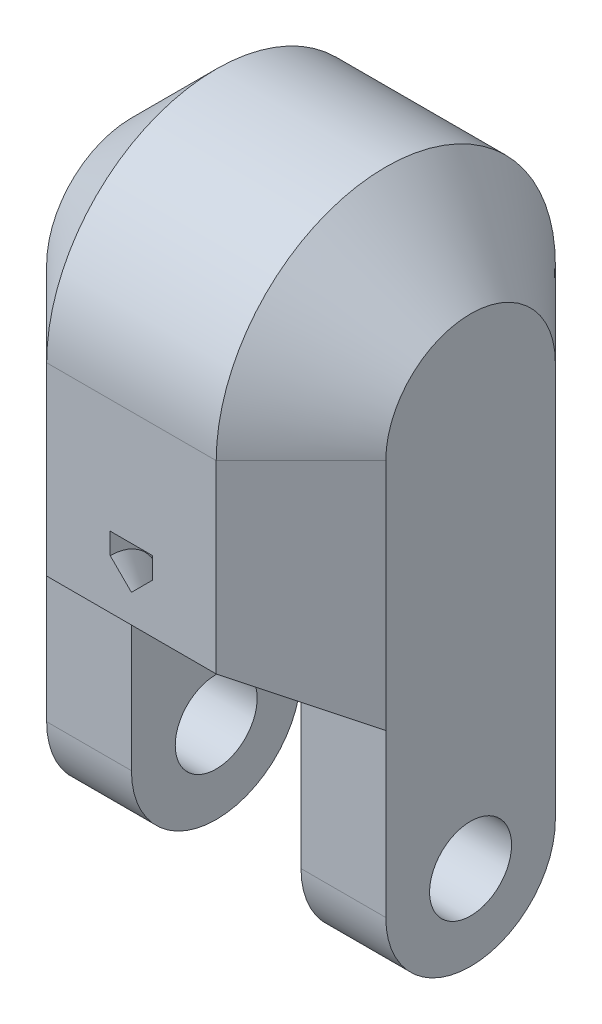
from build123d import *

# Parameters (mm, degrees)
BOSS_EXTRUDE1_DEPTH     = 5
CUT_EXTRUDE8_DEPTH      = 10.848857802
CUT_EXTRUDE8_DEPTH_BACK = 10.848857802
REVOLVE1_ANGLE          = 180
SKETCH24_W              = 3
SKETCH24_H              = 6
BOSS_EXTRUDE2_DEPTH     = 4
SKETCH25_W              = 3
SKETCH25_H              = 3
REVOLVE2_ANGLE          = 180
SKETCH26_R              = 1.45
CUT_EXTRUDE9_DEPTH      = 19
BOSS_EXTRUDE4_DEPTH     = 3.75


with BuildPart() as part:
    # Sketch2 → Boss-Extrude1 (new, symmetric)
    with BuildSketch(Plane(origin=(0, 0, 0), x_dir=(1, 0, 0), z_dir=(0, 1, 0))):
        Polygon((-3, 6), (3, 6), (6, 3), (6, -3), (3, -6), (-3, -6), (-6, -3), (-6, 3), align=None)
    extrude(amount=BOSS_EXTRUDE1_DEPTH, both=True)

    # Sketch22 → Cut-Extrude8 (cut, two sides: drawn at the far end of the back side and taken through both)
    with BuildSketch(Plane(origin=(0, 0, 0), x_dir=(0, 0, -1), z_dir=(1, 0, 0)).offset(-CUT_EXTRUDE8_DEPTH_BACK)):
        Polygon((0, -5), (-6, -5), (-6, -1.535898385), align=None)
    extrude(amount=CUT_EXTRUDE8_DEPTH + CUT_EXTRUDE8_DEPTH_BACK, mode=Mode.SUBTRACT)

    # Sketch23 → Revolve1 (revolve)
    with BuildSketch(Plane(origin=(0, 5, 0), x_dir=(1, 0, 0), z_dir=(0, 1, 0))):
        Polygon((-6, 0), (-6, 3), (-3, 6), (3, 6), (6, 3), (6, 0), align=None)
    revolve(axis=Axis((6, 5, 0), (1, 0, 0)), revolution_arc=REVOLVE1_ANGLE)

    # Sketch24 → Boss-Extrude2 (add, symmetric)
    with BuildSketch(Plane.XZ.offset(5)):
        with Locations((-4.5, 0)):
            Rectangle(SKETCH24_W, SKETCH24_H)
    boss_extrude2 = extrude(amount=BOSS_EXTRUDE2_DEPTH, both=True)

    # Sketch25 → Revolve2 (revolve)
    with BuildSketch(Plane.XZ.offset(9)):
        with Locations((-4.5, 1.5)):
            Rectangle(SKETCH25_W, SKETCH25_H)
    revolve2 = revolve(axis=Axis((-6, -9, 0), (1, 0, 0)), revolution_arc=REVOLVE2_ANGLE)

    # Sketch26 → Cut-Extrude9 (cut, symmetric)
    with BuildSketch(Plane.ZY.offset(6)):
        with Locations((0, -9)):
            Circle(SKETCH26_R)
    cut_extrude9 = extrude(amount=CUT_EXTRUDE9_DEPTH, both=True, mode=Mode.SUBTRACT)

    # Mirror1: Boss-Extrude2, Revolve2, Cut-Extrude9 across plane
    add(boss_extrude2.mirror(Plane(origin=(0, 0, 0), x_dir=(0, 0, 1), z_dir=(1, 0, 0))))
    add(revolve2.mirror(Plane(origin=(0, 0, 0), x_dir=(0, 0, 1), z_dir=(1, 0, 0))))
    add(cut_extrude9.mirror(Plane(origin=(0, 0, 0), x_dir=(0, 0, 1), z_dir=(1, 0, 0))), mode=Mode.SUBTRACT)

    # Sketch30 → Cut-Revolve1 (revolve, cut)
    with BuildSketch(Plane(origin=(0, -3.75, 2.165063509), x_dir=(1, 0, 0), z_dir=(0, -0.8660254037844418, 0.49999999999999484))):
        Polygon((0, 3.42820323), (-0.75, 2.67820323), (-0.75, 1.92820323), (0.75, 1.92820323), (0.75, 2.67820323), align=None)
    revolve(axis=Axis((-6, -1.535898385, 6), (1, 0, 0)), mode=Mode.SUBTRACT)

    # Sketch34 → Boss-Extrude4 (add)
    with BuildSketch(Plane.XZ.offset(5)):
        Polygon((-6, -3), (-3, -3), (3, -3), (6, -3), (3, -6), (-3, -6), align=None)
    extrude(amount=BOSS_EXTRUDE4_DEPTH)

    # Sketch35 → Cut-Revolve3 (revolve, cut)
    with BuildSketch(Plane.XZ.offset(8.75)):
        Polygon((0, -3.5), (-0.75, -4.25), (-0.75, -5), (0.75, -5), (0.75, -4.25), align=None)
    revolve(axis=Axis((3, -8.75, -6), (1, 0, 0)), mode=Mode.SUBTRACT)


solid = part.part
